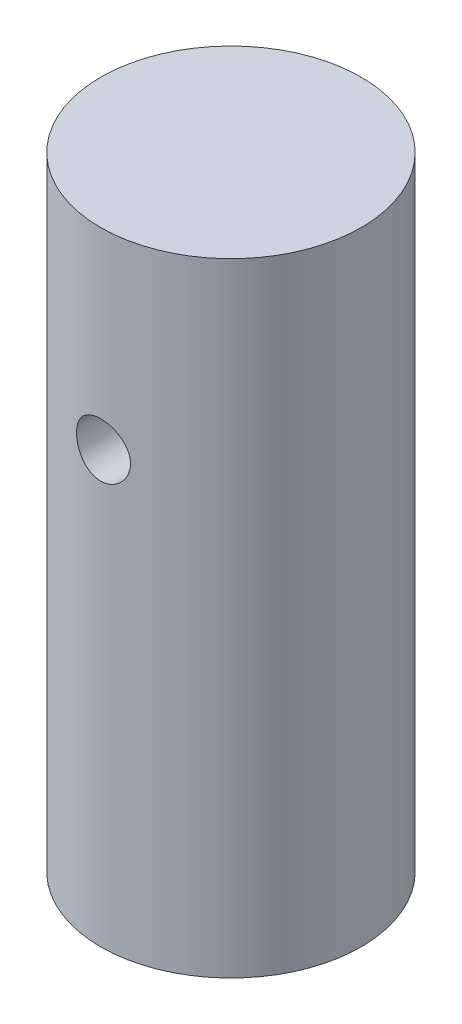
from build123d import *

# Parameters (mm, degrees)
SKETCH1_R           = 23
BOSS_EXTRUDE1_DEPTH = 110
SKETCH2_R           = 4.7625
CUT_EXTRUDE1_DEPTH  = 25


with BuildPart() as part:
    # Sketch1 → Boss-Extrude1 (new body)
    with BuildSketch(Plane(origin=(0, 0, 0), x_dir=(1, 0, 0), z_dir=(0, 1, 0))):
        Circle(SKETCH1_R)
    extrude(amount=BOSS_EXTRUDE1_DEPTH)

    # Sketch2 → Cut-Extrude1 (cut, symmetric)
    with BuildSketch(Plane.XY):
        with Locations((0, 76)):
            Circle(SKETCH2_R)
    extrude(amount=CUT_EXTRUDE1_DEPTH, both=True, mode=Mode.SUBTRACT)


solid = part.part
